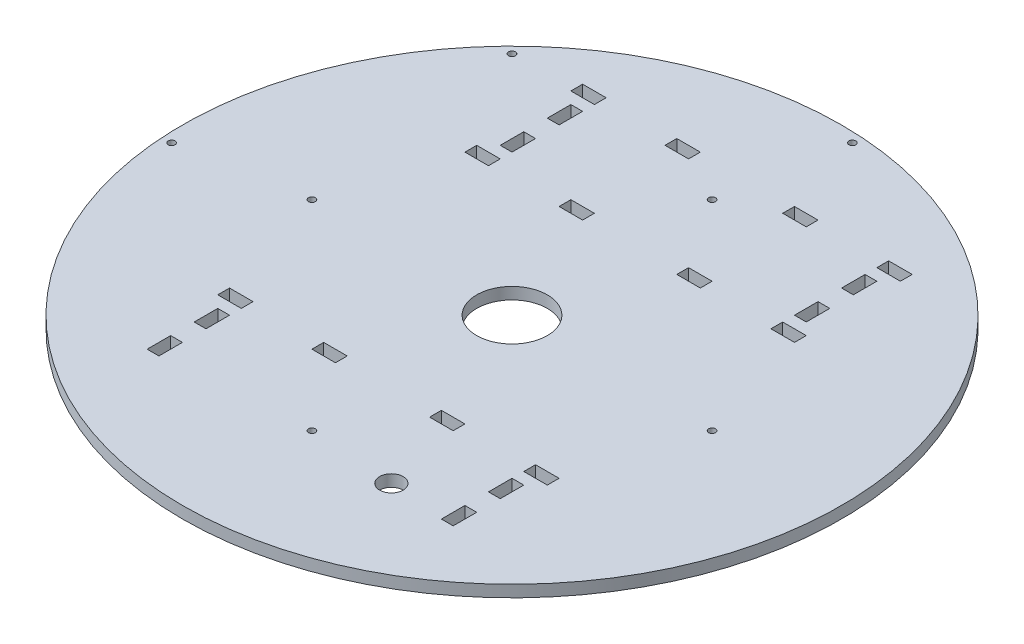
from build123d import *

# Parameters (mm, degrees)
MAIN_DISC_OUTLINE_R   = 177.8
MAIN_DISC_OUTLINE_W   = 6.35
MAIN_DISC_OUTLINE_H   = 12.7
MAIN_DISC_OUTLINE_W_2 = 12.7
MAIN_DISC_OUTLINE_H_2 = 6.35
MAIN_DISC_DEPTH       = 6.35
SKETCH2_R             = 19.05
SKETCH2_R_2           = 1.8542
SKETCH2_R_3           = 6.35
BEARING_HOLES_DEPTH   = 252.527339468
RACK_HOLES_DEPTH      = 252.527339468


# Read off the part's stored shape, not the designer's step: Main Disc
with BuildPart() as part:
    # Main Disc outline → Main Disc (new body)
    with BuildSketch(Plane(origin=(0, 0, 0), x_dir=(1, 0, 0), z_dir=(0, 1, 0))):
        Circle(MAIN_DISC_OUTLINE_R)
        with Locations((-79.375, -107.95)):
            Rectangle(MAIN_DISC_OUTLINE_W, MAIN_DISC_OUTLINE_H, mode=Mode.SUBTRACT)
        with Locations((-79.375, -82.55)):
            Rectangle(MAIN_DISC_OUTLINE_W, MAIN_DISC_OUTLINE_H, mode=Mode.SUBTRACT)
        with Locations((-82.55, -66.675)):
            Rectangle(MAIN_DISC_OUTLINE_W_2, MAIN_DISC_OUTLINE_H_2, mode=Mode.SUBTRACT)
        with Locations((-31.75, -66.675)):
            Rectangle(MAIN_DISC_OUTLINE_W_2, MAIN_DISC_OUTLINE_H_2, mode=Mode.SUBTRACT)
        with Locations((79.375, -107.95)):
            Rectangle(MAIN_DISC_OUTLINE_W, MAIN_DISC_OUTLINE_H, mode=Mode.SUBTRACT)
        with Locations((31.75, -66.675)):
            Rectangle(MAIN_DISC_OUTLINE_W_2, MAIN_DISC_OUTLINE_H_2, mode=Mode.SUBTRACT)
        with Locations((79.375, -82.55)):
            Rectangle(MAIN_DISC_OUTLINE_W, MAIN_DISC_OUTLINE_H, mode=Mode.SUBTRACT)
        with Locations((82.55, -66.675)):
            Rectangle(MAIN_DISC_OUTLINE_W_2, MAIN_DISC_OUTLINE_H_2, mode=Mode.SUBTRACT)
        with Locations((-82.55, 66.675)):
            Rectangle(MAIN_DISC_OUTLINE_W_2, MAIN_DISC_OUTLINE_H_2, mode=Mode.SUBTRACT)
        with Locations((-79.375, 82.55)):
            Rectangle(MAIN_DISC_OUTLINE_W, MAIN_DISC_OUTLINE_H, mode=Mode.SUBTRACT)
        with Locations((-31.75, 66.675)):
            Rectangle(MAIN_DISC_OUTLINE_W_2, MAIN_DISC_OUTLINE_H_2, mode=Mode.SUBTRACT)
        with Locations((-79.375, 107.95)):
            Rectangle(MAIN_DISC_OUTLINE_W, MAIN_DISC_OUTLINE_H, mode=Mode.SUBTRACT)
        with Locations((-82.55, 123.825)):
            Rectangle(MAIN_DISC_OUTLINE_W_2, MAIN_DISC_OUTLINE_H_2, mode=Mode.SUBTRACT)
        with Locations((-31.75, 123.825)):
            Rectangle(MAIN_DISC_OUTLINE_W_2, MAIN_DISC_OUTLINE_H_2, mode=Mode.SUBTRACT)
        with Locations((31.75, 66.675)):
            Rectangle(MAIN_DISC_OUTLINE_W_2, MAIN_DISC_OUTLINE_H_2, mode=Mode.SUBTRACT)
        with Locations((82.55, 66.675)):
            Rectangle(MAIN_DISC_OUTLINE_W_2, MAIN_DISC_OUTLINE_H_2, mode=Mode.SUBTRACT)
        with Locations((79.375, 82.55)):
            Rectangle(MAIN_DISC_OUTLINE_W, MAIN_DISC_OUTLINE_H, mode=Mode.SUBTRACT)
        with Locations((31.75, 123.825)):
            Rectangle(MAIN_DISC_OUTLINE_W_2, MAIN_DISC_OUTLINE_H_2, mode=Mode.SUBTRACT)
        with Locations((79.375, 107.95)):
            Rectangle(MAIN_DISC_OUTLINE_W, MAIN_DISC_OUTLINE_H, mode=Mode.SUBTRACT)
        with Locations((82.55, 123.825)):
            Rectangle(MAIN_DISC_OUTLINE_W_2, MAIN_DISC_OUTLINE_H_2, mode=Mode.SUBTRACT)
    extrude(amount=MAIN_DISC_DEPTH)

    # Sketch2 → Bearing Holes (cut, through all)
    with BuildSketch(Plane(origin=(0, 6.35, 0), x_dir=(1, 0, 0), z_dir=(0, 1, 0))):
        with Locations(Location((0, 0, 0), (0, 0, 270))):
            Circle(SKETCH2_R)
        with Locations(Location((0, -107.95, 0), (0, 0, 270))):
            Circle(SKETCH2_R_2)
        with Locations(Location((46.020093648, -111.102334226, 0), (0, 0, 270))):
            Circle(SKETCH2_R_3)
        with Locations(Location((107.95, 0, 0), (0, 0, 270))):
            Circle(SKETCH2_R_2)
        with Locations(Location((0, 107.95, 0), (0, 0, 270))):
            Circle(SKETCH2_R_2)
        with Locations(Location((-107.95, 0, 0), (0, 0, 270))):
            Circle(SKETCH2_R_2)
    extrude(amount=-BEARING_HOLES_DEPTH, mode=Mode.SUBTRACT)

    # Sketch3 → Rack Holes (cut, through all)
    with BuildSketch(Plane(origin=(0, 6.35, 0), x_dir=(1, 0, 0), z_dir=(0, 1, 0))):
        with BuildLine():
            ThreePointArc((-170.495993222, -11.296428481), (-170.496985984, -11.235760757), (-170.499963206, -11.175157998))
            Line((-170.499963206, -11.175157998), (-172.350193222, -11.296428481))
            ThreePointArc((-172.350193222, -11.296428481), (-172.4083456, -10.371150737), (-172.461530575, -9.445574182))
            ThreePointArc((-172.461530575, -9.445574182), (-173.621337572, -12.646335766), (-170.495993222, -11.296428481))
        make_face()
        with BuildLine():
            Line((-172.350193222, -11.296428481), (-170.499963206, -11.175157998))
            ThreePointArc((-170.499963206, -11.175157998), (-171.123897186, -9.905653275), (-172.461530575, -9.445574182))
            ThreePointArc((-172.461530575, -9.445574182), (-172.4083456, -10.371150737), (-172.350193222, -11.296428481))
        make_face()
        with BuildLine():
            ThreePointArc((-123.435544137, 120.813347125), (-122.126506883, 120.277289924), (-120.820365853, 120.820365853))
            Line((-120.820365853, 120.820365853), (-122.131483247, 122.131483247))
            ThreePointArc((-122.131483247, 122.131483247), (-122.785282527, 121.474165133), (-123.435544137, 120.813347125))
        make_face()
        with BuildLine():
            Line((-122.131483247, 122.131483247), (-120.820365853, 120.820365853))
            ThreePointArc((-120.820365853, 120.820365853), (-120.418425817, 121.421911626), (-120.277283247, 122.131483247))
            ThreePointArc((-120.277283247, 122.131483247), (-120.416527615, 122.836454751), (-120.813347125, 123.435544137))
            ThreePointArc((-120.813347125, 123.435544137), (-121.474165133, 122.785282527), (-122.131483247, 122.131483247))
        make_face()
        with BuildLine():
            ThreePointArc((-120.813347125, 123.435544137), (-123.44260064, 123.44260064), (-123.435544137, 120.813347125))
            ThreePointArc((-123.435544137, 120.813347125), (-122.785282527, 121.474165133), (-122.131483247, 122.131483247))
            ThreePointArc((-122.131483247, 122.131483247), (-121.474165133, 122.785282527), (-120.813347125, 123.435544137))
        make_face()
        with BuildLine():
            ThreePointArc((9.445574182, 172.461530575), (9.905653275, 171.123897186), (11.175157998, 170.499963206))
            Line((11.175157998, 170.499963206), (11.296428481, 172.350193222))
            ThreePointArc((11.296428481, 172.350193222), (10.371150737, 172.4083456), (9.445574182, 172.461530575))
        make_face()
        with BuildLine():
            Line((11.296428481, 172.350193222), (11.175157998, 170.499963206))
            ThreePointArc((11.175157998, 170.499963206), (12.563945327, 170.996879258), (13.150628481, 172.350193222))
            ThreePointArc((13.150628481, 172.350193222), (11.352122286, 174.203556608), (9.445574182, 172.461530575))
            ThreePointArc((9.445574182, 172.461530575), (10.371150737, 172.4083456), (11.296428481, 172.350193222))
        make_face()
    extrude(amount=-RACK_HOLES_DEPTH, mode=Mode.SUBTRACT)


solid = part.part
